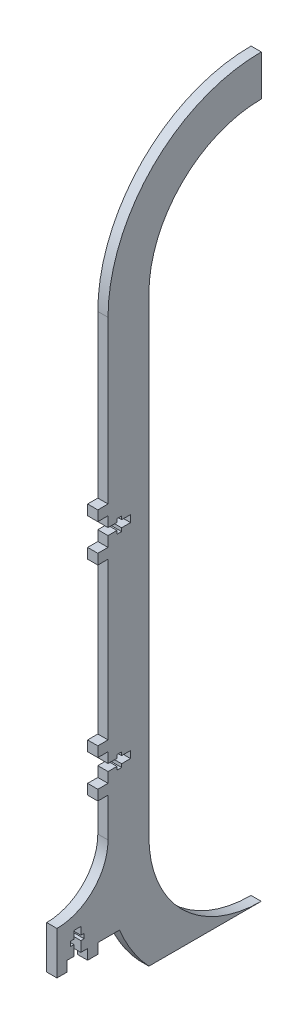
from build123d import *

# Parameters (mm, degrees)
BOSS_EXTRUDE2_DEPTH = 6.35


with BuildPart() as part:
    # Elevator Ball Support Rail → Boss-Extrude2 (new body)
    with BuildSketch(Plane(origin=(0, 0, 0), x_dir=(0, 0, -1), z_dir=(1, 0, 0))):
        with BuildLine():
            ThreePointArc((0, 146.05), (20.458591334, 195.441408666), (69.85, 215.9))
            Line((69.85, 215.9), (69.85, 241.3))
            ThreePointArc((69.85, 241.3), (2.498079092, 213.401920908), (-25.4, 146.05))
            Line((-25.4, 146.05), (-25.4, 45.593))
            Line((-25.4, 45.593), (-31.75, 45.593))
            Line((-31.75, 45.593), (-31.75, 39.243))
            Line((-31.75, 39.243), (-25.4, 39.243))
            Line((-25.4, 39.243), (-25.4, 32.893))
            Line((-25.4, 32.893), (-19.865000021, 32.893))
            Line((-19.865000021, 32.893), (-19.865000021, 34.933999982))
            Line((-19.865000021, 34.933999982), (-16.964999979, 34.933999982))
            Line((-16.964999979, 34.933999982), (-16.964999979, 32.893))
            Line((-16.964999979, 32.893), (-11.43, 32.893))
            Line((-11.43, 32.893), (-11.43, 28.575))
            Line((-11.43, 28.575), (-16.964999979, 28.575))
            Line((-16.964999979, 28.575), (-16.964999979, 26.534000018))
            Line((-16.964999979, 26.534000018), (-19.865000021, 26.534000018))
            Line((-19.865000021, 26.534000018), (-19.865000021, 28.575))
            Line((-19.865000021, 28.575), (-25.4, 28.575))
            Line((-25.4, 28.575), (-25.4, 22.225))
            Line((-25.4, 22.225), (-31.75, 22.225))
            Line((-31.75, 22.225), (-31.75, 15.875))
            Line((-31.75, 15.875), (-25.4, 15.875))
            Line((-25.4, 15.875), (-25.4, -81.407))
            Line((-25.4, -81.407), (-31.75, -81.407))
            Line((-31.75, -81.407), (-31.75, -87.757))
            Line((-31.75, -87.757), (-25.4, -87.757))
            Line((-25.4, -87.757), (-25.4, -94.107))
            Line((-25.4, -94.107), (-19.865000021, -94.107))
            Line((-19.865000021, -94.107), (-19.865000021, -92.066000018))
            Line((-19.865000021, -92.066000018), (-16.964999979, -92.066000018))
            Line((-16.964999979, -92.066000018), (-16.964999979, -94.107))
            Line((-16.964999979, -94.107), (-11.43, -94.107))
            Line((-11.43, -94.107), (-11.43, -98.425))
            Line((-11.43, -98.425), (-16.964999979, -98.425))
            Line((-16.964999979, -98.425), (-16.964999979, -100.465999982))
            Line((-16.964999979, -100.465999982), (-19.865000021, -100.465999982))
            Line((-19.865000021, -100.465999982), (-19.865000021, -98.425))
            Line((-19.865000021, -98.425), (-25.4, -98.425))
            Line((-25.4, -98.425), (-25.4, -104.775))
            Line((-25.4, -104.775), (-31.75, -104.775))
            Line((-31.75, -104.775), (-31.75, -111.125))
            Line((-31.75, -111.125), (-25.4, -111.125))
            Line((-25.4, -111.125), (-25.4, -128.905))
            Line((-25.4, -128.905), (-25.4, -135.255))
            ThreePointArc((-25.4, -135.255), (-34.699359697, -157.705640303), (-57.15, -167.005))
            Line((-57.15, -167.005), (-57.15, -193.675))
            Line((-57.15, -193.675), (-50.8, -193.675))
            Line((-50.8, -193.675), (-50.8, -187.325))
            Line((-50.8, -187.325), (-46.609, -187.325))
            Line((-46.609, -187.325), (-46.609, -180.975))
            Line((-46.609, -180.975), (-48.649999982, -180.975))
            Line((-48.649999982, -180.975), (-48.649999982, -178.074999958))
            Line((-48.649999982, -178.074999958), (-46.609, -178.074999958))
            Line((-46.609, -178.074999958), (-46.609, -173.355))
            Line((-46.609, -173.355), (-42.291, -173.355))
            Line((-42.291, -173.355), (-42.291, -178.074999958))
            Line((-42.291, -178.074999958), (-40.250000018, -178.074999958))
            Line((-40.250000018, -178.074999958), (-40.250000018, -180.975))
            Line((-40.250000018, -180.975), (-42.291, -180.975))
            Line((-42.291, -180.975), (-42.291, -187.325))
            Line((-42.291, -187.325), (-38.1, -187.325))
            Line((-38.1, -187.325), (-38.1, -193.675))
            Line((-38.1, -193.675), (-31.75, -193.675))
            Line((-31.75, -193.675), (-31.75, -187.325))
            Line((-31.75, -187.325), (-18.260077364, -187.325))
            ThreePointArc((-18.260077364, -187.325), (-10.411940959, -202.43166482), (0, -215.9))
            Line((0, -215.9), (69.85, -215.9))
            ThreePointArc((69.85, -215.9), (20.458591334, -195.441408666), (0, -146.05))
            Line((0, -146.05), (0, 146.05))
        make_face()
    extrude(amount=BOSS_EXTRUDE2_DEPTH)


solid = part.part
